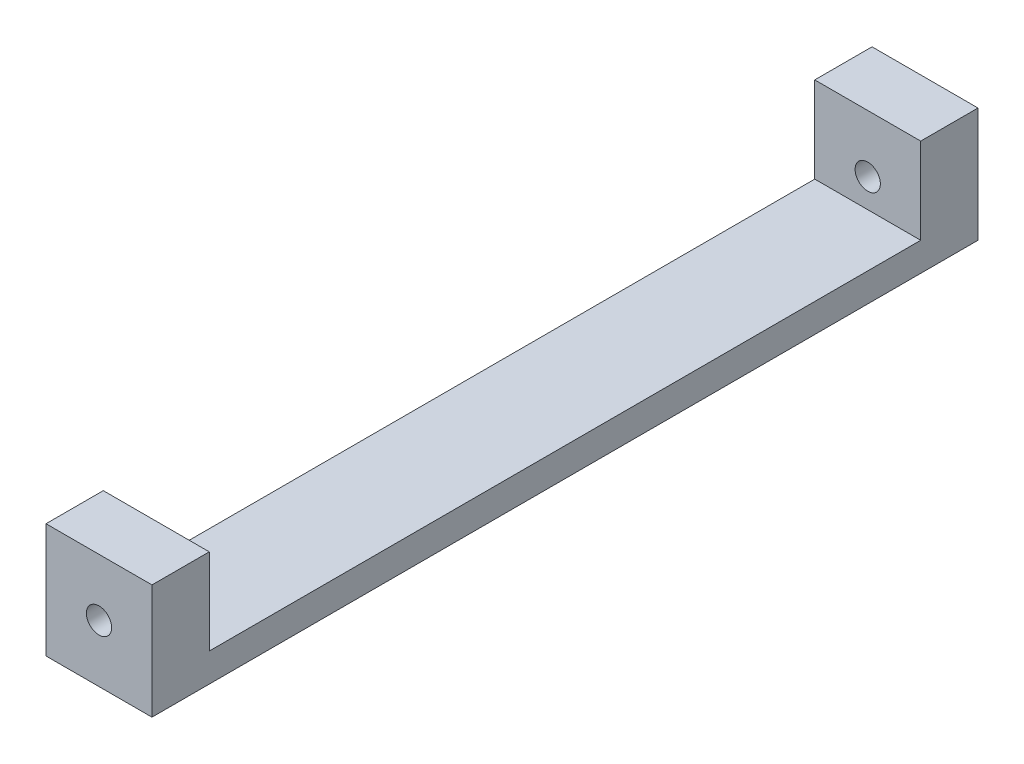
from build123d import *

# Parameters (mm, degrees)
SKETCH1_W           = 11.7475
SKETCH1_H           = 91.567
BOSS_EXTRUDE1_DEPTH = 3.175
SKETCH5_W           = 11.7475
SKETCH5_H           = 9.525
BOSS_EXTRUDE2_DEPTH = 6.35
SKETCH4_R           = 1.399999994
CUT_EXTRUDE1_DEPTH  = 93.629943474


with BuildPart() as part:
    # Sketch1 → Boss-Extrude1 (new body)
    with BuildSketch(Plane(origin=(0, 0, 0), x_dir=(1, 0, 0), z_dir=(0, 1, 0))):
        Rectangle(SKETCH1_W, SKETCH1_H)
    extrude(amount=BOSS_EXTRUDE1_DEPTH)

    # Sketch5 → Boss-Extrude2 (add)
    with BuildSketch(Plane.XY.offset(45.7835)):
        with Locations((0, 7.9375)):
            Rectangle(SKETCH5_W, SKETCH5_H)
    boss_extrude2 = extrude(amount=-BOSS_EXTRUDE2_DEPTH)

    # Mirror1: Boss-Extrude2 across plane
    add(boss_extrude2.mirror(Plane.XY))

    # Sketch4 → Cut-Extrude1 (cut, through all)
    with BuildSketch(Plane.XY.offset(45.7835)):
        with Locations((0, 6.35)):
            Circle(SKETCH4_R)
    extrude(amount=-CUT_EXTRUDE1_DEPTH, mode=Mode.SUBTRACT)


solid = part.part
